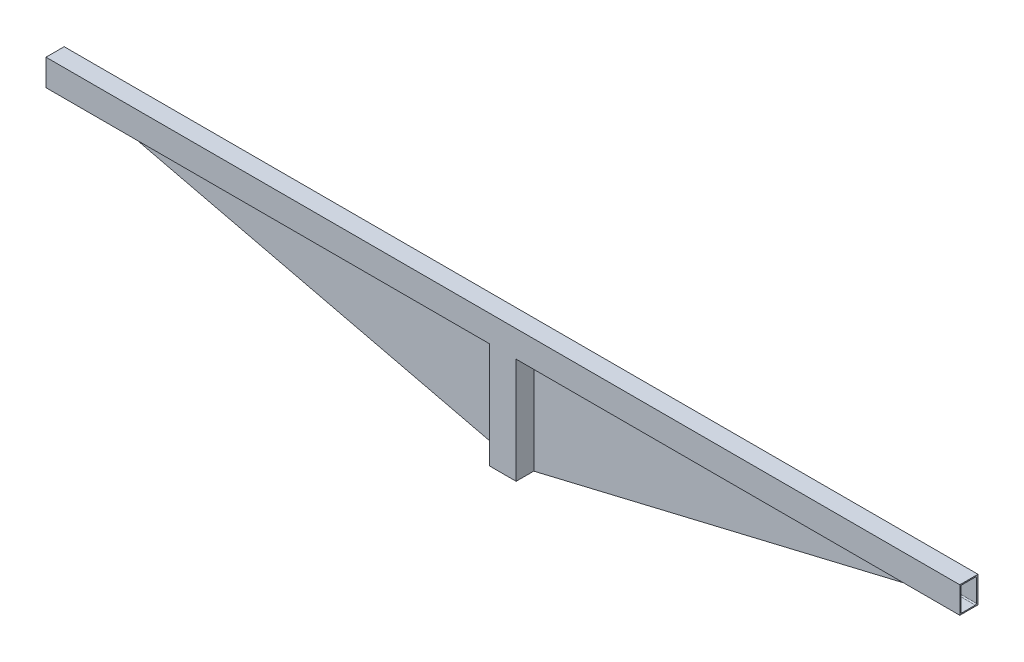
from build123d import *

# Parameters (mm, degrees)
SKETCH1_W           = 101.6
SKETCH1_H           = 152.4
BOSS_EXTRUDE1_DEPTH = 5265.200001456
SKETCH2_W           = 152.4
SKETCH2_H           = 101.6
BOSS_EXTRUDE2_DEPTH = 609.6
BOSS_EXTRUDE3_DEPTH = 3.175


with BuildPart() as part:
    # Sketch1 → Boss-Extrude1 (new body)
    with BuildSketch(Plane(origin=(0, 0, 0), x_dir=(0, 0, -1), z_dir=(1, 0, 0))):
        with Locations((-50.8, 76.2)):
            Rectangle(SKETCH1_W, SKETCH1_H)
        with BuildLine():
            Line((-95.25, 12.7), (-95.25, 139.7))
            ThreePointArc((-95.25, 139.7), (-93.390128061, 144.190128061), (-88.9, 146.05))
            Line((-88.9, 146.05), (-12.7, 146.05))
            ThreePointArc((-12.7, 146.05), (-8.209871939, 144.190128061), (-6.35, 139.7))
            Line((-6.35, 139.7), (-6.35, 12.7))
            ThreePointArc((-6.35, 12.7), (-8.209871939, 8.209871939), (-12.7, 6.35))
            Line((-12.7, 6.35), (-88.9, 6.35))
            ThreePointArc((-88.9, 6.35), (-93.390128061, 8.209871939), (-95.25, 12.7))
        make_face(mode=Mode.SUBTRACT)
    extrude(amount=BOSS_EXTRUDE1_DEPTH)

    # Sketch2 → Boss-Extrude2 (add)
    with BuildSketch(Plane(origin=(0, 0, 0), x_dir=(-1, 0, 0), z_dir=(0, -1, 0))):
        with Locations((-2632.600000728, -50.8)):
            Rectangle(SKETCH2_W, SKETCH2_H)
        with BuildLine():
            Line((-2562.750000728, -88.9), (-2562.750000728, -12.7))
            ThreePointArc((-2562.750000728, -12.7), (-2564.609872667, -8.209871939), (-2569.100000728, -6.35))
            Line((-2569.100000728, -6.35), (-2696.100000728, -6.35))
            ThreePointArc((-2696.100000728, -6.35), (-2700.590128789, -8.209871939), (-2702.450000728, -12.7))
            Line((-2702.450000728, -12.7), (-2702.450000728, -88.9))
            ThreePointArc((-2702.450000728, -88.9), (-2700.590128789, -93.390128061), (-2696.100000728, -95.25))
            Line((-2696.100000728, -95.25), (-2569.100000728, -95.25))
            ThreePointArc((-2569.100000728, -95.25), (-2564.609872667, -93.390128061), (-2562.750000728, -88.9))
        make_face(mode=Mode.SUBTRACT)
    extrude(amount=BOSS_EXTRUDE2_DEPTH)

    # Sketch3 → Boss-Extrude3 (add)
    with BuildSketch(Plane(origin=(0, 0, 0), x_dir=(-1, 0, 0), z_dir=(0, 0, -1))):
        Polygon((-2708.800000728, -609.6), (-2556.400000728, -609.6), (0, 0), (0, 152.4), (-5265.200001456, 152.4), (-5265.200001456, 0), align=None)
    extrude(amount=BOSS_EXTRUDE3_DEPTH)


solid = part.part
